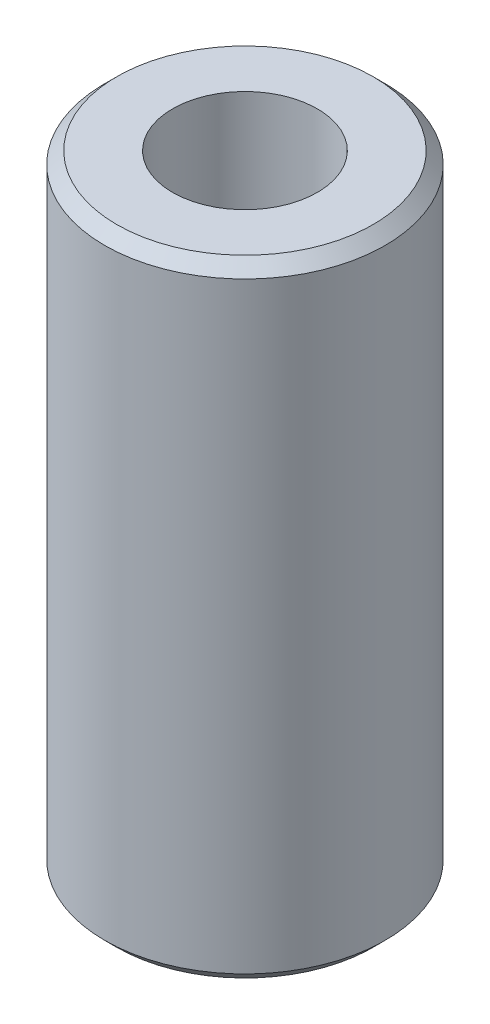
from build123d import *

# Parameters (mm, degrees)
SKETCH1_R           = 25
BOSS_EXTRUDE1_DEPTH = 111.609927979
SKETCH2_R           = 12.914536469
CUT_EXTRUDE1_DEPTH  = 118.075941266
CHAMFER1_SIZE       = 2.149551353


with BuildPart() as part:
    # Sketch1 → Boss-Extrude1 (new body)
    with BuildSketch(Plane(origin=(0, 0, 0), x_dir=(1, 0, 0), z_dir=(0, 1, 0))):
        Circle(SKETCH1_R)
    extrude(amount=BOSS_EXTRUDE1_DEPTH)

    # Sketch2 → Cut-Extrude1 (cut, through all)
    with BuildSketch(Plane(origin=(0, 0, 0), x_dir=(1, 0, 0), z_dir=(0, 1, 0))):
        Circle(SKETCH2_R)
    extrude(amount=CUT_EXTRUDE1_DEPTH, mode=Mode.SUBTRACT)

    # Chamfer1
    chamfer1_edges = [part.edges().sort_by_distance(p)[0] for p in [
        (-25, 111.609927979, 0),
        (-25, 0, 0),
    ]]
    chamfer(chamfer1_edges, length=CHAMFER1_SIZE)


solid = part.part
